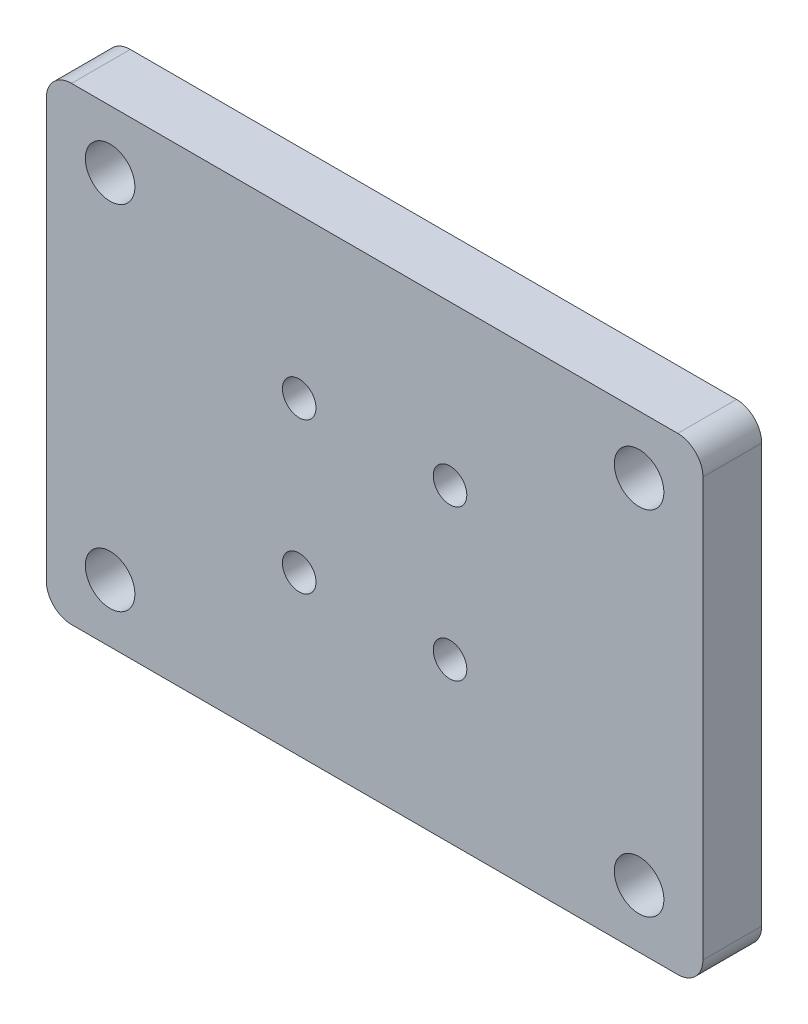
from build123d import *

# Parameters (mm, degrees)
EXTRUDE_1_DEPTH     = 7
CUT_EXTRUDE_1_DEPTH = 49.546658999
F_4_0MM_2_OUTLINE_R = 2
F_4_0MM_2_DEPTH     = 7
SKETCH_6_R          = 20.5
CUT_EXTRUDE_2_DEPTH = 2


# Read off the part's stored shape, not the designer's step: Ø4.0mm 暗销孔2
with BuildPart() as part:
    # 草图2 → 凸台-拉伸1 (new body)
    with BuildSketch(Plane.XY):
        with BuildLine():
            Line((-36.1, 27.91), (36.1, 27.91))
            ThreePointArc((36.1, 27.91), (38.221320344, 27.031320344), (39.1, 24.91))
            Line((39.1, 24.91), (39.1, -24.91))
            ThreePointArc((39.1, -24.91), (38.221320344, -27.031320344), (36.1, -27.91))
            Line((36.1, -27.91), (-36.1, -27.91))
            ThreePointArc((-36.1, -27.91), (-38.221320344, -27.031320344), (-39.1, -24.91))
            Line((-39.1, -24.91), (-39.1, 24.91))
            ThreePointArc((-39.1, 24.91), (-38.221320344, 27.031320344), (-36.1, 27.91))
        make_face()
    extrude(amount=EXTRUDE_1_DEPTH)

    # 草图1 → 切除-拉伸1 (cut, through all)
    with BuildSketch(Plane.XY):
        with BuildLine():
            Line((-31.5, 18.05), (-31.5, 21))
            Line((-31.5, 21), (-28.55, 21))
            ThreePointArc((-28.55, 21), (-33.585965005, 23.085965005), (-31.5, 18.05))
        make_face()
        with BuildLine():
            Line((-28.55, 21), (-31.5, 21))
            Line((-31.5, 21), (-31.5, 18.05))
            ThreePointArc((-31.5, 18.05), (-29.414034995, 18.914034995), (-28.55, 21))
        make_face()
        with BuildLine():
            ThreePointArc((34.45, 21), (31.5, 23.95), (28.55, 21))
            Line((28.55, 21), (31.5, 21))
            Line((31.5, 21), (31.5, 18.05))
            ThreePointArc((31.5, 18.05), (33.585965005, 18.914034995), (34.45, 21))
        make_face()
        with BuildLine():
            Line((31.5, 21), (28.55, 21))
            ThreePointArc((28.55, 21), (29.414034995, 18.914034995), (31.5, 18.05))
            Line((31.5, 18.05), (31.5, 21))
        make_face()
        with BuildLine():
            ThreePointArc((-28.55, -21), (-29.414034995, -18.914034995), (-31.5, -18.05))
            Line((-31.5, -18.05), (-31.5, -21))
            Line((-31.5, -21), (-28.55, -21))
        make_face()
        with BuildLine():
            Line((-31.5, -21), (-31.5, -18.05))
            ThreePointArc((-31.5, -18.05), (-33.585965005, -23.085965005), (-28.55, -21))
            Line((-28.55, -21), (-31.5, -21))
        make_face()
        with BuildLine():
            ThreePointArc((34.45, -21), (33.585965005, -18.914034995), (31.5, -18.05))
            Line((31.5, -18.05), (31.5, -21))
            Line((31.5, -21), (28.55, -21))
            ThreePointArc((28.55, -21), (31.5, -23.95), (34.45, -21))
        make_face()
        with BuildLine():
            Line((31.5, -21), (31.5, -18.05))
            ThreePointArc((31.5, -18.05), (29.414034995, -18.914034995), (28.55, -21))
            Line((28.55, -21), (31.5, -21))
        make_face()
    extrude(amount=CUT_EXTRUDE_1_DEPTH, mode=Mode.SUBTRACT)

    # Ø4.0mm 暗销孔2 outline → Ø4.0mm 暗销孔2 (cut)
    with BuildSketch(Plane.XY):
        with Locations((8.980256121, -8.980256121)):
            Circle(F_4_0MM_2_OUTLINE_R)
        with Locations((-8.980256121, -8.980256121)):
            Circle(F_4_0MM_2_OUTLINE_R)
        with Locations((-8.980256121, 8.980256121)):
            Circle(F_4_0MM_2_OUTLINE_R)
        with Locations((8.980256121, 8.980256121)):
            Circle(F_4_0MM_2_OUTLINE_R)
    extrude(amount=F_4_0MM_2_DEPTH, mode=Mode.SUBTRACT)

    # 草图6 → 切除-拉伸2 (cut)
    with BuildSketch(Plane(origin=(0, 0, 0), x_dir=(-1, 0, 0), z_dir=(0, 0, -1))):
        Circle(SKETCH_6_R)
    extrude(amount=-CUT_EXTRUDE_2_DEPTH, mode=Mode.SUBTRACT)


solid = part.part
